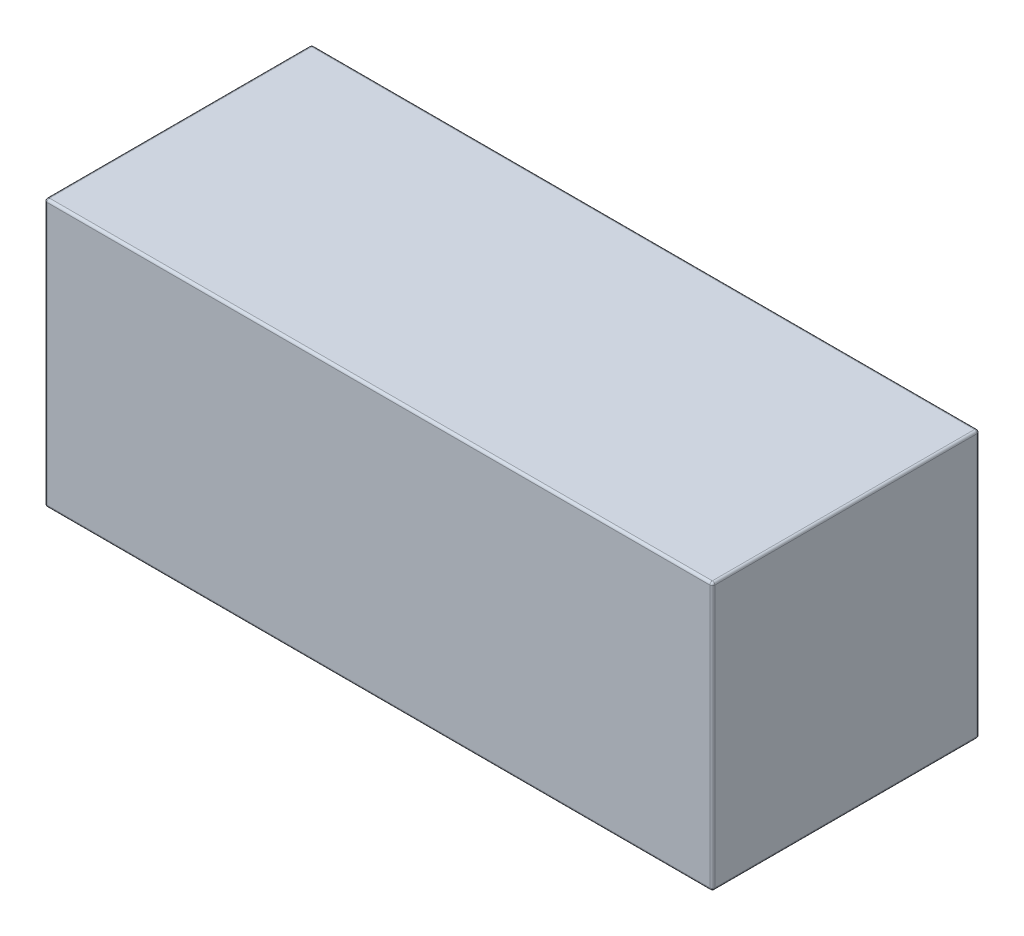
from build123d import *

# Parameters (mm, degrees)
ESQUISSE1_W               = 135
ESQUISSE1_H               = 54
BOSS_EXTRU_1_DEPTH        = 54
ESQUISSE2_W               = 10.5
ESQUISSE2_H               = 10.5
ENL_V_MAT_EXTRU_1_DEPTH   = 4.5
CONG_1_R                  = 0.5
SYM_TRIE2_COPY_1_SKETCH_W = 10.5
SYM_TRIE2_COPY_1_SKETCH_H = 10.5
SYM_TRIE2_COPY_1_DEPTH    = 4.5
SYM_TRIE2_COPY_2_SKETCH_W = 10.5
SYM_TRIE2_COPY_2_SKETCH_H = 10.5
SYM_TRIE2_COPY_2_DEPTH    = 4.5


with BuildPart() as part:
    # Esquisse1 → Boss.-Extru.1 (new body)
    with BuildSketch(Plane.XY):
        with Locations((67.5, -27)):
            Rectangle(ESQUISSE1_W, ESQUISSE1_H)
    extrude(amount=BOSS_EXTRU_1_DEPTH)

    # Esquisse2 → Enlèv. mat.-Extru.1 (cut)
    with BuildSketch(Plane.XZ.offset(54)):
        with Locations((67.5, 45.75)):
            Rectangle(ESQUISSE2_W, ESQUISSE2_H)
        with Locations((83.25, 27)):
            Rectangle(ESQUISSE2_W, ESQUISSE2_H)
    enl_v_mat_extru_1 = extrude(amount=-ENL_V_MAT_EXTRU_1_DEPTH, mode=Mode.SUBTRACT)

    # Congé1
    cong_1_edges = [part.edges().sort_by_distance(p)[0] for p in [
        (0, -54, 27),
        (67.5, -54, 54),
        (0, -27, 54),
        (135, -54, 27),
        (135, -27, 54),
        (67.5, -54, 0),
        (135, -27, 0),
        (0, -27, 0),
        (135, 0, 27),
        (67.5, 0, 54),
        (0, 0, 27),
        (67.5, 0, 0),
    ]]
    fillet(cong_1_edges, radius=CONG_1_R)

    # Symétrie1: Enlèv. mat.-Extru.1 across plane
    add(enl_v_mat_extru_1.mirror(Plane(origin=(67.5, 0, 0), x_dir=(0, 0, 1), z_dir=(1, 0, 0))), mode=Mode.SUBTRACT)

    # Symétrie2 copy 1 sketch → Symétrie2 copy 1 (cut)
    with BuildSketch(Plane(origin=(135, -54, 54), x_dir=(-1, 0, 0), z_dir=(0, -1, 0))):
        with Locations((67.5, 45.75)):
            Rectangle(SYM_TRIE2_COPY_1_SKETCH_W, SYM_TRIE2_COPY_1_SKETCH_H)
        with Locations((83.25, 27)):
            Rectangle(SYM_TRIE2_COPY_1_SKETCH_W, SYM_TRIE2_COPY_1_SKETCH_H)
    extrude(amount=-SYM_TRIE2_COPY_1_DEPTH, mode=Mode.SUBTRACT)

    # Symétrie2 copy 2 sketch → Symétrie2 copy 2 (cut)
    with BuildSketch(Plane(origin=(0, -54, 54), x_dir=(1, 0, 0), z_dir=(0, -1, 0))):
        with Locations((67.5, -45.75)):
            Rectangle(SYM_TRIE2_COPY_2_SKETCH_W, SYM_TRIE2_COPY_2_SKETCH_H)
        with Locations((83.25, -27)):
            Rectangle(SYM_TRIE2_COPY_2_SKETCH_W, SYM_TRIE2_COPY_2_SKETCH_H)
    extrude(amount=-SYM_TRIE2_COPY_2_DEPTH, mode=Mode.SUBTRACT)


solid = part.part
